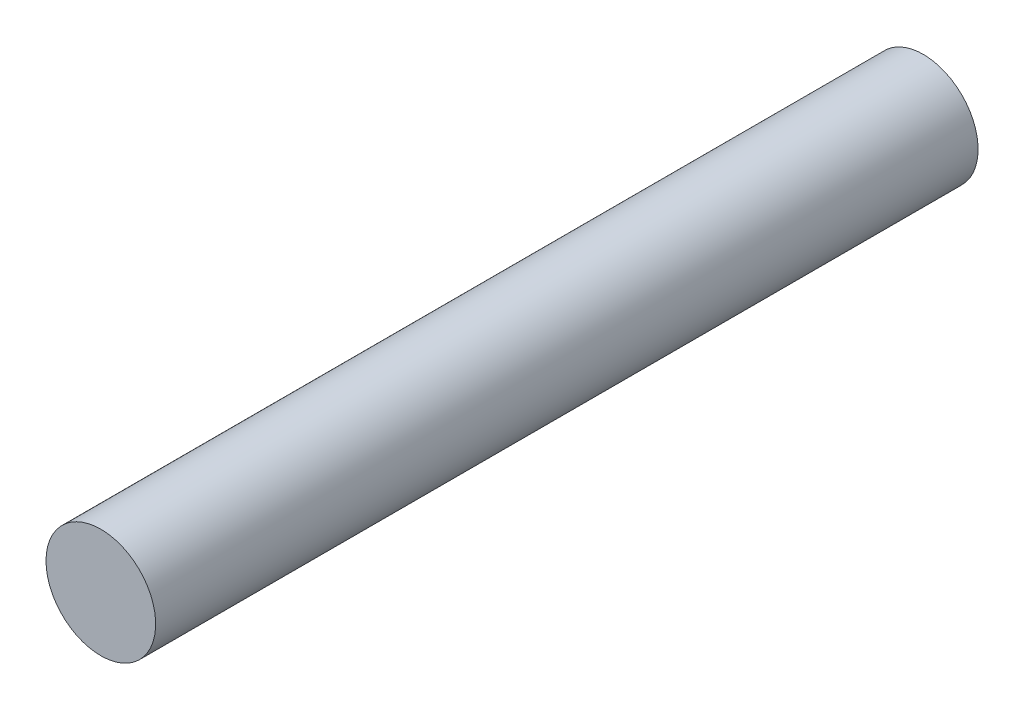
from build123d import *

# Parameters (mm, degrees)
SKETCH_1_R      = 3
EXTRUDE_1_DEPTH = 45


with BuildPart() as part:
    # Эскиз1 → Вытянуть1 (new body)
    with BuildSketch(Plane.XY):
        Circle(SKETCH_1_R)
    extrude(amount=EXTRUDE_1_DEPTH)


solid = part.part
